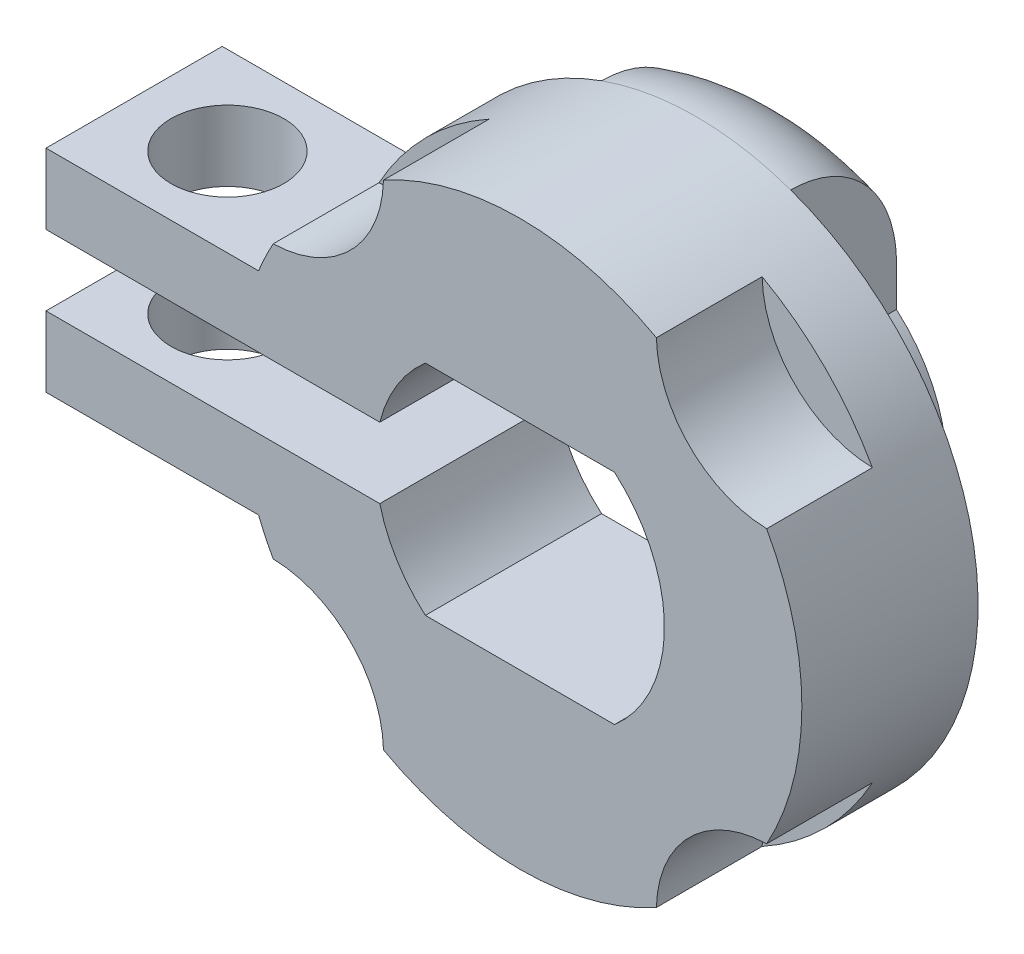
from build123d import *

# Parameters (mm, degrees)
SKETCH_1_R          = 14
SKETCH_1_R_2        = 1.5
EXTRUDE_1_DEPTH     = 2
CUT_EXTRUDE_1_DEPTH = 20.899748742
EXTRUDE_4_DEPTH     = 2.5
EXTRUDE_START       = 5
SKETCH_6_R          = 8
EXTRUDE_5_DEPTH     = 5
EXTRUDE_START_2     = 1
EXTRUDE_6_DEPTH     = 1
SKETCH_8_W          = 8
SKETCH_8_H          = 2
EXTRUDE_7_DEPTH     = 5
SKETCH_9_R          = 1.6
CUT_EXTRUDE_3_DEPTH = 24.606143268
EXTRUDE_START_3     = 2
EXTRUDE_8_DEPTH     = 2
SKETCH_11_W         = 12.041493288
SKETCH_11_H         = 2
CUT_EXTRUDE_4_DEPTH = 5
FILLET_2_R          = 3
CUT_EXTRUDE_START   = -4.5
SKETCH_12_R         = 14
CUT_EXTRUDE_5_DEPTH = 4.5
SKETCH_13_R         = 3.2
CUT_EXTRUDE_6_DEPTH = 3


with BuildPart() as part:
    # 草图1 → 凸台-拉伸1 (new body)
    with BuildSketch(Plane.XY):
        Circle(SKETCH_1_R)
        with Locations((-7.071067812, 7.071067812)):
            Circle(SKETCH_1_R_2, mode=Mode.SUBTRACT)
        with Locations((7.071067812, 7.071067812)):
            Circle(SKETCH_1_R_2, mode=Mode.SUBTRACT)
        with Locations((-7.071067812, -7.071067812)):
            Circle(SKETCH_1_R_2, mode=Mode.SUBTRACT)
        with Locations((7.071067812, -7.071067812)):
            Circle(SKETCH_1_R_2, mode=Mode.SUBTRACT)
    extrude(amount=EXTRUDE_1_DEPTH)

    # 草图2 → 切除-拉伸1 (cut, through all)
    with BuildSketch(Plane(origin=(0, 0, 0), x_dir=(-1, 0, 0), z_dir=(0, 0, -1))):
        with BuildLine():
            ThreePointArc((-2.683281573, 3.1), (-4.1, 0), (-2.683281573, -3.1))
            Line((-2.683281573, -3.1), (2.683281573, -3.1))
            ThreePointArc((2.683281573, -3.1), (4.1, 0), (2.683281573, 3.1))
            Line((2.683281573, 3.1), (-2.683281573, 3.1))
        make_face()
    extrude(amount=-CUT_EXTRUDE_1_DEPTH, mode=Mode.SUBTRACT)

    # 草图3 → 凸台-拉伸4 (add)
    with BuildSketch(Plane(origin=(0, 0, 0), x_dir=(-1, 0, 0), z_dir=(0, 0, -1))):
        Polygon((0, 3.1), (3.7, 3.1), (3.7, 7.1), (-3.7, 7.1), (-3.7, 3.1), align=None)
    extrude(amount=EXTRUDE_4_DEPTH)

    # 草图6 → 凸台-拉伸5 (add)
    with BuildSketch(Plane(origin=(0, 0, -2.5), x_dir=(-1, 0, 0), z_dir=(0, 0, -1)).offset(EXTRUDE_START)):
        Circle(SKETCH_6_R)
        with BuildLine():
            Line((-2.683281573, -3.1), (2.683281573, -3.1))
            ThreePointArc((2.683281573, -3.1), (4.1, 0), (2.683281573, 3.1))
            Line((2.683281573, 3.1), (-2.683281573, 3.1))
            ThreePointArc((-2.683281573, 3.1), (-4.1, 0), (-2.683281573, -3.1))
        make_face(mode=Mode.SUBTRACT)
    extrude(amount=-EXTRUDE_5_DEPTH)

    # 草图7 → 凸台-拉伸6 (add)
    with BuildSketch(Plane(origin=(0, 0, -7.5), x_dir=(-1, 0, 0), z_dir=(0, 0, -1)).offset(EXTRUDE_START_2)):
        with BuildLine():
            Line((-2.683281573, 3.1), (-2.683281573, 7.536577473))
            ThreePointArc((-2.683281573, 7.536577473), (0, 8), (2.683281573, 7.536577473))
            Line((2.683281573, 7.536577473), (2.683281573, 3.1))
            Line((2.683281573, 3.1), (-2.683281573, 3.1))
        make_face()
    extrude(amount=-EXTRUDE_6_DEPTH)

    # 草图8 → 凸台-拉伸7 (add)
    with BuildSketch(Plane(origin=(0, 0, -7.5), x_dir=(-1, 0, 0), z_dir=(0, 0, -1))):
        with Locations((9.447401339, 2)):
            Rectangle(SKETCH_8_W, SKETCH_8_H)
        with Locations((9.447401339, -2)):
            Rectangle(SKETCH_8_W, SKETCH_8_H)
    extrude(amount=-EXTRUDE_7_DEPTH)

    # 草图9 → 切除-拉伸3 (cut, through all)
    with BuildSketch(Plane(origin=(0, 3, 0), x_dir=(1, 0, 0), z_dir=(0, 1, 0))):
        with Locations((-10.8, 5)):
            Circle(SKETCH_9_R)
    extrude(amount=-CUT_EXTRUDE_3_DEPTH, mode=Mode.SUBTRACT)

    # 草图10 → 凸台-拉伸8 (add)
    with BuildSketch(Plane(origin=(0, 0, -8.5), x_dir=(-1, 0, 0), z_dir=(0, 0, -1)).offset(EXTRUDE_START_3)):
        with BuildLine():
            Line((-2.683281573, 7.536577473), (-2.683281573, 3.1))
            ThreePointArc((-2.683281573, 3.1), (0, -4.1), (2.683281573, 3.1))
            Line((2.683281573, 3.1), (2.683281573, 7.536577473))
            ThreePointArc((2.683281573, 7.536577473), (0, 8), (-2.683281573, 7.536577473))
        make_face()
    extrude(amount=-EXTRUDE_8_DEPTH)

    # 草图11 → 切除-拉伸4 (cut)
    with BuildSketch(Plane(origin=(0, 0, -7.5), x_dir=(-1, 0, 0), z_dir=(0, 0, -1))):
        with Locations((7.426654695, 0)):
            Rectangle(SKETCH_11_W, SKETCH_11_H)
    extrude(amount=-CUT_EXTRUDE_4_DEPTH, mode=Mode.SUBTRACT)

    # 圆角2
    fillet_2_edges = [part.edges().sort_by_distance(p)[0] for p in [
        (0, 8, -10.5),
    ]]
    fillet(fillet_2_edges, radius=FILLET_2_R)

    # 草图12 → 切除-拉伸5 (cut)
    with BuildSketch(Plane.XY.offset(2).offset(CUT_EXTRUDE_START)):
        Circle(SKETCH_12_R)
    extrude(amount=CUT_EXTRUDE_5_DEPTH, mode=Mode.SUBTRACT)

    # 草图13 → 切除-拉伸6 (cut)
    with BuildSketch(Plane.XY.offset(-2.5)):
        with Locations((-7.071067812, 7.071067812)):
            Circle(SKETCH_13_R)
        with Locations((7.071067812, 7.071067812)):
            Circle(SKETCH_13_R)
        with Locations((-7.071067812, -7.071067812)):
            Circle(SKETCH_13_R)
        with Locations((7.071067812, -7.071067812)):
            Circle(SKETCH_13_R)
    extrude(amount=-CUT_EXTRUDE_6_DEPTH, mode=Mode.SUBTRACT)


solid = part.part
